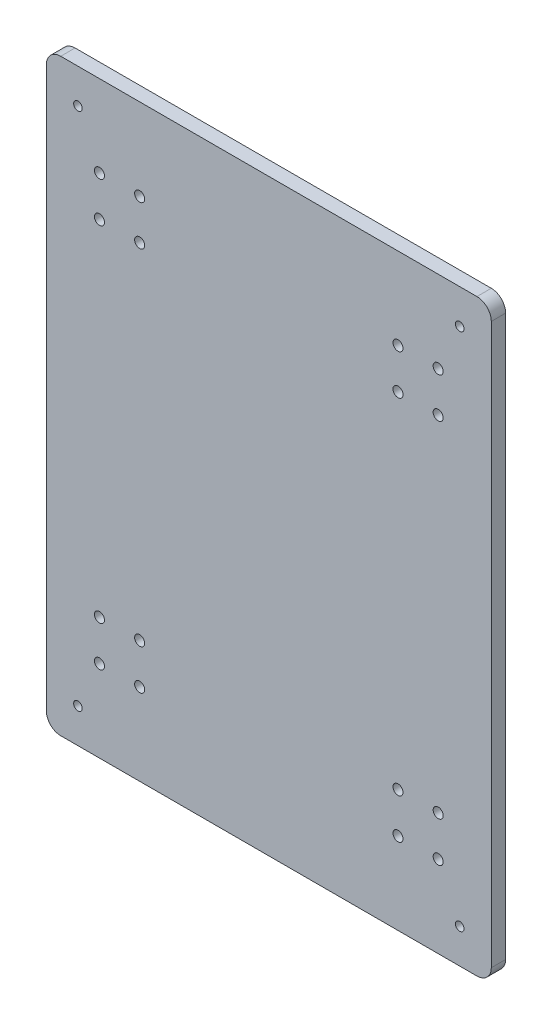
from build123d import *

# Parameters (mm, degrees)
SKETCH_1_W               = 155
SKETCH_1_H               = 205
EXTRUDE_1_DEPTH          = 5
SKETCH_2_R               = 1.75
CUT_EXTRUDE_1_DEPTH      = 129.598211496
MIRROR_2_COPY_1_SKETCH_R = 1.75
MIRROR_2_COPY_1_DEPTH    = 129.598211496
MIRROR_2_COPY_2_SKETCH_R = 1.75
MIRROR_2_COPY_2_DEPTH    = 129.598211496
FILLET_1_R               = 5
CUT_EXTRUDE_2_DEPTH      = 129.598211496
CUT_EXTRUDE_2_DEPTH_BACK = 129.598211496
SKETCH_3_R               = 1.5


with BuildPart() as part:
    # ｽｹｯﾁ1 → ﾎﾞｽ - 押し出し1 (new body)
    with BuildSketch(Plane.XY):
        Rectangle(SKETCH_1_W, SKETCH_1_H)
    extrude(amount=EXTRUDE_1_DEPTH)

    # ｽｹｯﾁ2 → ｶｯﾄ - 押し出し1 (cut, through all)
    with BuildSketch(Plane.XY.offset(5)):
        with Locations((45, 74)):
            Circle(SKETCH_2_R)
        with Locations((59, 74)):
            Circle(SKETCH_2_R)
        with Locations((45, 60)):
            Circle(SKETCH_2_R)
        with Locations((59, 60)):
            Circle(SKETCH_2_R)
    cut_extrude_1 = extrude(amount=-CUT_EXTRUDE_1_DEPTH, mode=Mode.SUBTRACT)

    # ﾐﾗｰ1: ｶｯﾄ - 押し出し1 across plane
    add(cut_extrude_1.mirror(Plane.ZX), mode=Mode.SUBTRACT)

    # ﾐﾗｰ2 copy 1 sketch → ﾐﾗｰ2 copy 1 (cut, through all)
    with BuildSketch(Plane(origin=(0, 0, 5), x_dir=(-1, 0, 0), z_dir=(0, 0, 1))):
        with Locations((45, 74)):
            Circle(MIRROR_2_COPY_1_SKETCH_R)
        with Locations((59, 74)):
            Circle(MIRROR_2_COPY_1_SKETCH_R)
        with Locations((45, 60)):
            Circle(MIRROR_2_COPY_1_SKETCH_R)
        with Locations((59, 60)):
            Circle(MIRROR_2_COPY_1_SKETCH_R)
    extrude(amount=-MIRROR_2_COPY_1_DEPTH, mode=Mode.SUBTRACT)

    # ﾐﾗｰ2 copy 2 sketch → ﾐﾗｰ2 copy 2 (cut, through all)
    with BuildSketch(Plane(origin=(0, 0, 5), x_dir=(-1, 0, 0), z_dir=(0, 0, 1))):
        with Locations((45, -74)):
            Circle(MIRROR_2_COPY_2_SKETCH_R)
        with Locations((59, -74)):
            Circle(MIRROR_2_COPY_2_SKETCH_R)
        with Locations((45, -60)):
            Circle(MIRROR_2_COPY_2_SKETCH_R)
        with Locations((59, -60)):
            Circle(MIRROR_2_COPY_2_SKETCH_R)
    extrude(amount=-MIRROR_2_COPY_2_DEPTH, mode=Mode.SUBTRACT)

    # ﾌｨﾚｯﾄ1
    fillet_1_edges = [part.edges().sort_by_distance(p)[0] for p in [
        (-77.5, -102.5, 2.5),
        (77.5, -102.5, 2.5),
        (77.5, 102.5, 2.5),
        (-77.5, 102.5, 2.5),
    ]]
    fillet(fillet_1_edges, radius=FILLET_1_R)

    # ｽｹｯﾁ3 → ｶｯﾄ - 押し出し2 (cut, two sides: drawn at the far end of the back side and taken through both)
    with BuildSketch(Plane.XY.offset(5).offset(-CUT_EXTRUDE_2_DEPTH_BACK)):
        with Locations((-66.5, 90.5)):
            Circle(SKETCH_3_R)
        with Locations((66.5, 90.5)):
            Circle(SKETCH_3_R)
        with Locations((-66.5, -90.5)):
            Circle(SKETCH_3_R)
        with Locations((66.5, -90.5)):
            Circle(SKETCH_3_R)
    extrude(amount=CUT_EXTRUDE_2_DEPTH + CUT_EXTRUDE_2_DEPTH_BACK, mode=Mode.SUBTRACT)


solid = part.part
